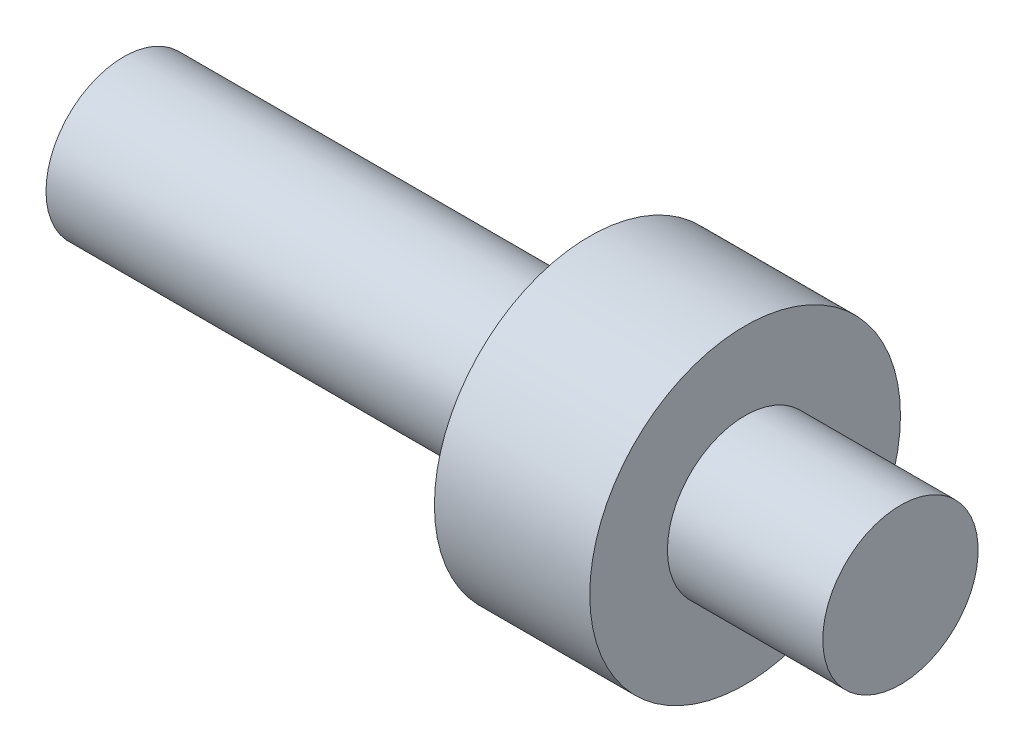
from build123d import *


with BuildPart() as part:
    # Sketch1 → Revolve1 (revolve)
    with BuildSketch(Plane.XY):
        Polygon((0, 0), (12.7, 0), (12.7, 3.175), (6.35, 3.175), (6.35, 6.35), (0, 6.35), (0, 3.175), (-19.05, 3.175), (-19.05, 0), align=None)
    revolve(axis=Axis((-19.05, 0, 0), (1, 0, 0)))


solid = part.part
